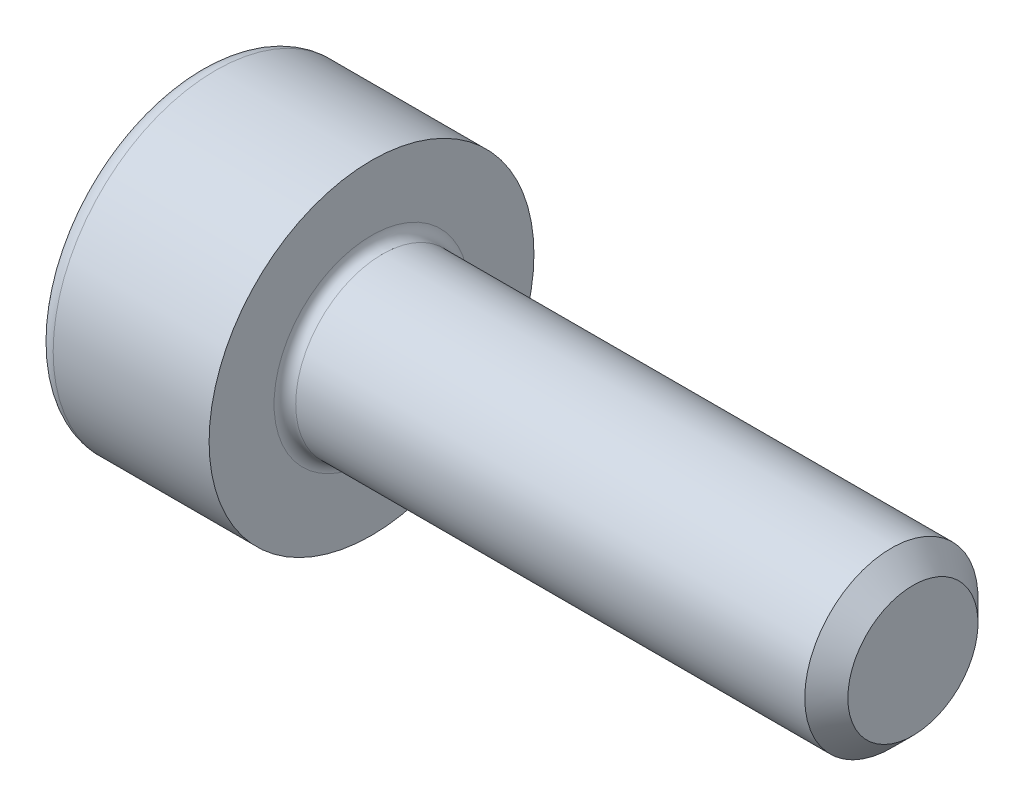
from build123d import *

# Parameters (mm, degrees)
FILLET1_R   = 0.1
FILLET2_R   = 0.16
HEX_2_DEPTH = 0.7


with BuildPart() as part:
    # BodySke → Base-Revolve (revolve)
    with BuildSketch(Plane.XY):
        Polygon((0, 0), (0, 1.5), (1.6, 1.5), (1.6, 0.8), (6.401, 0.8), (6.6, 0.601), (6.6, 0), align=None)
    revolve(axis=Axis((-31.75, 0, 0), (1, 0, 0)))

    # Fillet1
    fillet1_edges = [part.edges().sort_by_distance(p)[0] for p in [
        (1.6, -0.8, 0),
    ]]
    fillet(fillet1_edges, radius=FILLET1_R)

    # Fillet2
    fillet2_edges = [part.edges().sort_by_distance(p)[0] for p in [
        (0, -1.5, 0),
    ]]
    fillet(fillet2_edges, radius=FILLET2_R)

    # Sketch2 → Hex-PreBroach (revolve, cut)
    with BuildSketch(Plane.XY):
        Polygon((0, 0.76), (0.7, 0.76), (1.138786205, 0), (0, 0), align=None)
    revolve(axis=Axis((0, 0, 0), (1, 0, 0)), mode=Mode.SUBTRACT)

    # Sketch3 → Hex 2 (cut)
    with BuildSketch(Plane(origin=(0, 0, 0), x_dir=(0, 0.500000000000001, 0.866025403784438), z_dir=(-1, 0, 0))):
        Polygon((0.438786205, 0.76), (-0.438786205, 0.76), (-0.877572409, 0), (-0.438786205, -0.76), (0.438786205, -0.76), (0.877572409, 0), align=None)
    extrude(amount=-HEX_2_DEPTH, mode=Mode.SUBTRACT)


solid = part.part
